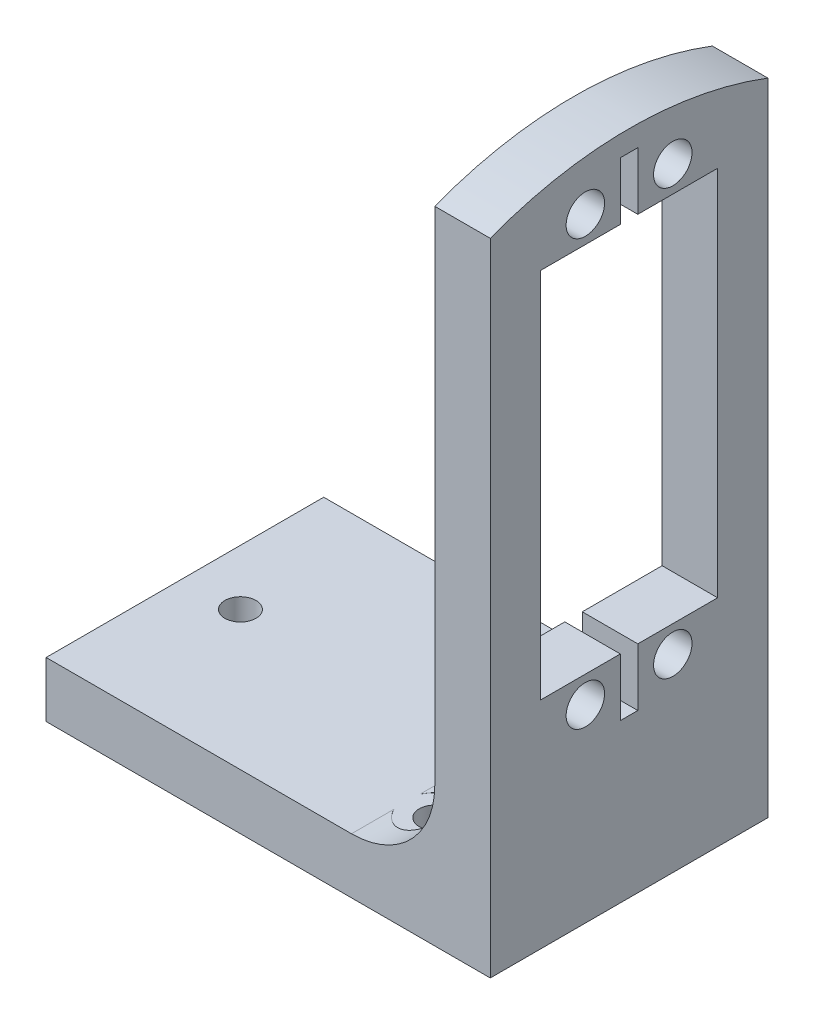
from build123d import *

# Parameters (mm, degrees)
SKETCH3_W               = 31.75
SKETCH3_H               = 73.557500078
SKETCH3_R               = 2.200000045
BOSS_EXTRUDE1_DEPTH     = 6.35
SKETCH5_W               = 31.75
SKETCH5_H               = 6.35
BOSS_EXTRUDE2_DEPTH     = 50.8
FILLET1_R               = 9.525
CUT_EXTRUDE1_DEPTH      = 92.621890494
CUT_EXTRUDE1_DEPTH_BACK = 92.621890494
SKETCH6_R               = 1.777000002
CUT_EXTRUDE2_DEPTH      = 95.865211348
SKETCH8_R               = 3.499999985
CUT_EXTRUDE3_DEPTH      = 89.672924314


with BuildPart() as part:
    # Sketch3 → Boss-Extrude1 (new body)
    with BuildSketch(Plane(origin=(0, 0, 0), x_dir=(0, 0, -1), z_dir=(1, 0, 0))):
        with Locations((15.875, 36.778750039)):
            Rectangle(SKETCH3_W, SKETCH3_H)
        with Locations((10.874999967, 15.285000037)):
            Circle(SKETCH3_R, mode=Mode.SUBTRACT)
        with Locations((20.875000033, 15.285000037)):
            Circle(SKETCH3_R, mode=Mode.SUBTRACT)
        with Locations((10.874999967, 63.885000119)):
            Circle(SKETCH3_R, mode=Mode.SUBTRACT)
        with Locations((20.875000033, 63.885000119)):
            Circle(SKETCH3_R, mode=Mode.SUBTRACT)
        Polygon((5.748000061, 60.857500078), (14.875, 60.857500078), (14.875, 67.461500078), (16.875, 67.461500078), (16.875, 60.857500078), (26.001999939, 60.857500078), (26.001999939, 18.312500078), (16.875, 18.312500078), (16.875, 11.708500078), (14.875, 11.708500078), (14.875, 18.312500078), (5.748000061, 18.312500078), align=None, mode=Mode.SUBTRACT)
    extrude(amount=BOSS_EXTRUDE1_DEPTH)

    # Sketch5 → Boss-Extrude2 (add)
    with BuildSketch(Plane(origin=(6.35, 0, 0), x_dir=(0, 0, -1), z_dir=(1, 0, 0))):
        with Locations((15.875, -3.175)):
            Rectangle(SKETCH5_W, SKETCH5_H)
    extrude(amount=-BOSS_EXTRUDE2_DEPTH)

    # Fillet1
    fillet1_edges = [part.edges().sort_by_distance(p)[0] for p in [
        (0, 0, -15.875),
    ]]
    fillet(fillet1_edges, radius=FILLET1_R)

    # Sketch6 → Cut-Extrude1 (cut, two sides: drawn at the far end of the back side and taken through both)
    with BuildSketch(Plane(origin=(0, 0, 0), x_dir=(1, 0, 0), z_dir=(0, 1, 0)).offset(-CUT_EXTRUDE1_DEPTH_BACK)):
        with Locations((-6.35, 6.35)):
            Circle(SKETCH6_R)
        with Locations((-38.1, 15.875)):
            Circle(SKETCH6_R)
        with Locations((-6.35, 25.4)):
            Circle(SKETCH6_R)
    extrude(amount=CUT_EXTRUDE1_DEPTH + CUT_EXTRUDE1_DEPTH_BACK, mode=Mode.SUBTRACT)

    # Sketch7 → Cut-Extrude2 (cut, through all)
    with BuildSketch(Plane(origin=(6.35, 0, 0), x_dir=(0, 0, -1), z_dir=(1, 0, 0))):
        with BuildLine():
            Line((0, 66.918512437), (0, 82.748877538))
            Line((0, 82.748877538), (31.75, 82.748877538))
            Line((31.75, 82.748877538), (31.75, 66.918512437))
            ThreePointArc((31.75, 66.918512437), (15.875, 69.85), (0, 66.918512437))
        make_face()
    extrude(amount=-CUT_EXTRUDE2_DEPTH, mode=Mode.SUBTRACT)

    # Sketch8 → Cut-Extrude3 (cut, through all)
    with BuildSketch(Plane(origin=(0, 0, 0), x_dir=(1, 0, 0), z_dir=(0, 1, 0))):
        with Locations((-6.35, 25.4)):
            Circle(SKETCH8_R)
        with Locations((-6.35, 6.35)):
            Circle(SKETCH8_R)
    extrude(amount=CUT_EXTRUDE3_DEPTH, mode=Mode.SUBTRACT)


solid = part.part
